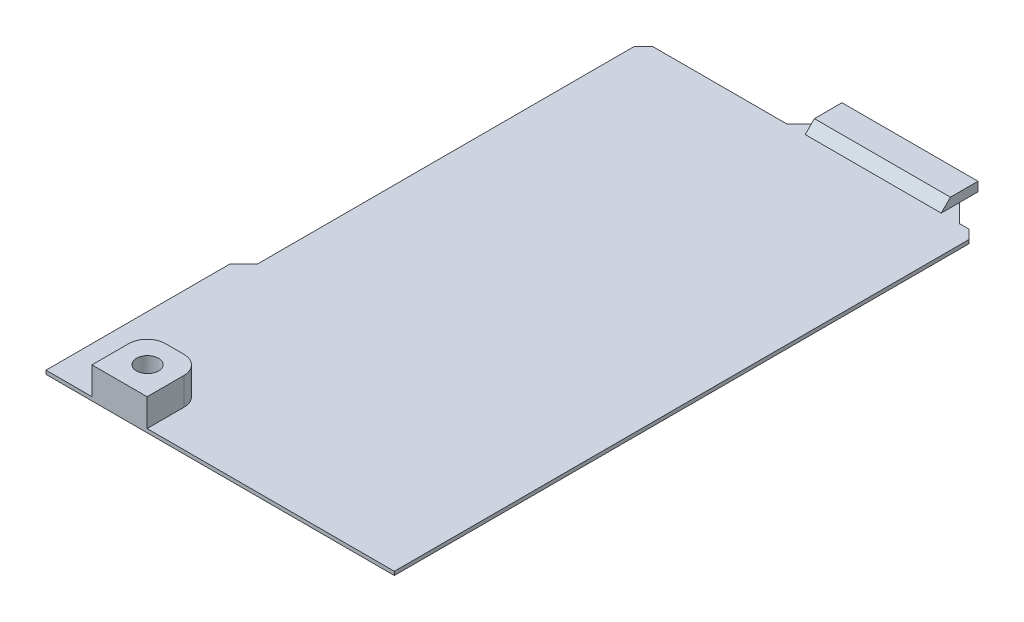
from build123d import *

# Parameters (mm, degrees)
EXTRUDE_1_DEPTH     = 1
CHAMFER_1_SIZE      = 0.6
SKETCH_2_W          = 14.8
SKETCH_2_H          = 4
EXTRUDE_2_DEPTH     = 1
EXTRUDE_3_DEPTH     = 3
SKETCH_4_R          = 1.2
CUT_EXTRUDE_1_DEPTH = 78.515546828
SKETCH_5_R          = 2.05
CUT_EXTRUDE_2_DEPTH = 2
CHAMFER_2_SIZE      = 1


with BuildPart() as part:
    # 草图1 → 凸台-拉伸1 (new body)
    with BuildSketch(Plane(origin=(0, 0, 0), x_dir=(1, 0, 0), z_dir=(0, 1, 0))):
        Polygon((0, 0), (37.9, 0), (37.9, 62.5), (36.9, 63.5), (35.9, 63.5), (33.9, 65.5), (19.1, 65.5), (17.1, 63.5), (2.5, 63.5), (1.5, 62.5), (1.5, 21.5), (0, 20), align=None)
    extrude(amount=EXTRUDE_1_DEPTH)

    # 倒角1
    chamfer_1_edges = [part.edges().sort_by_distance(p)[0] for p in [
        (0.75, 0, -20.75),
        (1.5, 0, -42),
        (2, 0, -63),
        (9.8, 0, -63.5),
        (18.1, 0, -64.5),
        (26.5, 0, -65.5),
        (34.9, 0, -64.5),
        (36.4, 0, -63.5),
        (37.4, 0, -63),
        (37.9, 0, -31.25),
        (18.95, 0, 0),
        (0, 0, -10),
    ]]
    chamfer(chamfer_1_edges, length=CHAMFER_1_SIZE)

    # 草图2 → 凸台-拉伸2 (add)
    with BuildSketch(Plane(origin=(0, 1, 0), x_dir=(1, 0, 0), z_dir=(0, 1, 0))):
        with Locations((26.5, 65.5)):
            Rectangle(SKETCH_2_W, SKETCH_2_H)
    extrude(amount=EXTRUDE_2_DEPTH)

    # 草图3 → 凸台-拉伸3 (add)
    with BuildSketch(Plane(origin=(0, 1, 0), x_dir=(1, 0, 0), z_dir=(0, 1, 0))):
        with BuildLine():
            Line((5, 4), (5, 0))
            Line((5, 0), (11, 0))
            Line((11, 0), (11, 4))
            ThreePointArc((11, 4), (10.414213562, 5.414213562), (9, 6))
            Line((9, 6), (7, 6))
            ThreePointArc((7, 6), (5.585786438, 5.414213562), (5, 4))
        make_face()
    extrude(amount=EXTRUDE_3_DEPTH)

    # 草图4 → 切除-拉伸1 (cut, through all)
    with BuildSketch(Plane.XZ):
        with Locations(Location((8, -3.05, 0), (0, 0, 270))):
            Circle(SKETCH_4_R)
    extrude(amount=-CUT_EXTRUDE_1_DEPTH, mode=Mode.SUBTRACT)

    # 草图5 → 切除-拉伸2 (cut)
    with BuildSketch(Plane.XZ):
        with Locations(Location((8, -3.05, 0), (0, 0, 270))):
            Circle(SKETCH_5_R)
    extrude(amount=-CUT_EXTRUDE_2_DEPTH, mode=Mode.SUBTRACT)

    # 倒角2
    chamfer_2_edges = [part.edges().sort_by_distance(p)[0] for p in [
        (26.5, 2, -63.5),
    ]]
    chamfer(chamfer_2_edges, length=CHAMFER_2_SIZE - 0.0001)  # a hair under: the kernel refuses the full size


solid = part.part
